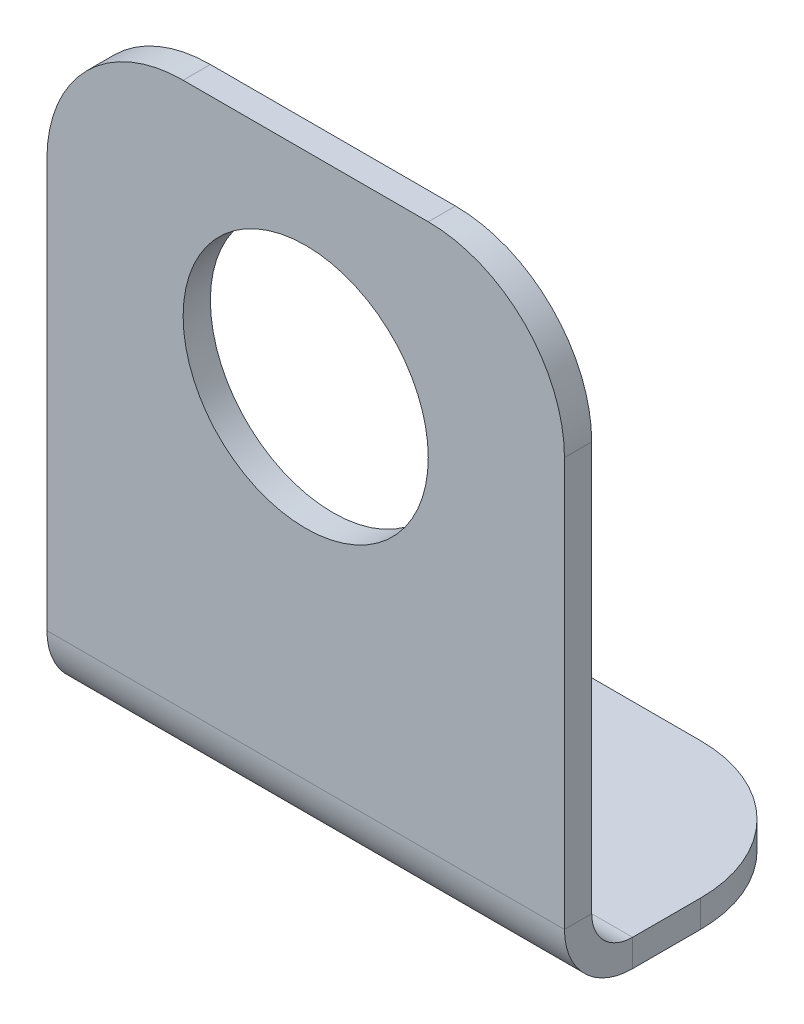
from build123d import *

# Parameters (mm, degrees)
SKETCH_1_W             = 38
SKETCH_1_H             = 40
SKETCH_1_R             = 9
SM_BASE_FLANGE_1_DEPTH = 2
SM_EDGE_FLANGE_1_DEPTH = 38
FILLET_1_R             = 10


# Sheet-metal steps are written as plain solids
with BuildPart() as part:
    # Sketch 1 → 基体-法兰1 (new body)
    with BuildSketch(Plane.XY):
        with Locations((0, -5)):
            Rectangle(SKETCH_1_W, SKETCH_1_H)
        Circle(SKETCH_1_R, mode=Mode.SUBTRACT)
    extrude(amount=-SM_BASE_FLANGE_1_DEPTH)

    # 边线-法兰1 section (across the edge) → 边线-法兰1 (add)
    with BuildSketch(Plane(origin=(19, -28, -2), x_dir=(0, 1, 0), z_dir=(-1, 0, 0))):
        with BuildLine():
            Line((-2, 3), (-2, 18))
            Line((-2, 18), (0, 18))
            Line((0, 18), (0, 3))
            ThreePointArc((0, 3), (0.878679656, 0.878679656), (3, 0))
            Line((3, 0), (3, -2))
            ThreePointArc((3, -2), (-0.535533906, -0.535533906), (-2, 3))
        make_face()
    extrude(amount=SM_EDGE_FLANGE_1_DEPTH)

    # 圆角1
    fillet_1_edges = [part.edges().sort_by_distance(p)[0] for p in [
        (19, -29, -20),
        (-19, -29, -20),
        (19, 15, -1),
        (-19, 15, -1),
    ]]
    fillet(fillet_1_edges, radius=FILLET_1_R)


solid = part.part
